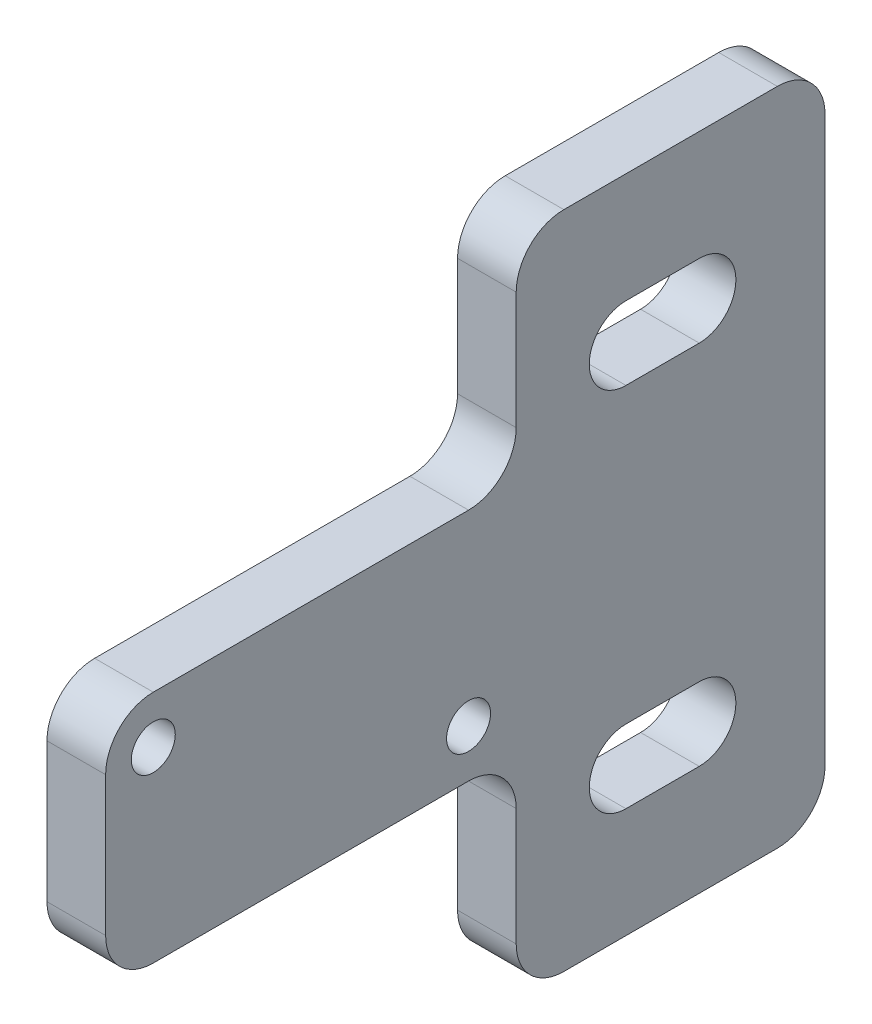
from build123d import *

# Parameters (mm, degrees)
SKETCH1_R           = 1.5
BOSS_EXTRUDE1_DEPTH = 4
FILLET1_R           = 3.25


with BuildPart() as part:
    # Sketch1 → Boss-Extrude1 (new body)
    with BuildSketch(Plane.YZ):
        Polygon((0, 28), (0, 0), (-14.5, 0), (-14.5, -21.061852547), (30.5, -21.061852547), (30.5, 0), (16, 0), (16, 28), align=None)
        with Locations((3.25, 3.25)):
            Circle(SKETCH1_R, mode=Mode.SUBTRACT)
        with Locations((12.75, 24.75)):
            Circle(SKETCH1_R, mode=Mode.SUBTRACT)
        with BuildLine():
            Line((23, -7.483396654), (23, -12.483396654))
            ThreePointArc((23, -12.483396654), (20.5, -14.983396654), (18, -12.483396654))
            Line((18, -12.483396654), (18, -7.483396654))
            ThreePointArc((18, -7.483396654), (20.5, -4.983396654), (23, -7.483396654))
        make_face(mode=Mode.SUBTRACT)
        with BuildLine():
            ThreePointArc((-7, -7.483396654), (-4.5, -4.983396654), (-2, -7.483396654))
            Line((-2, -7.483396654), (-2, -12.483396654))
            ThreePointArc((-2, -12.483396654), (-4.5, -14.983396654), (-7, -12.483396654))
            Line((-7, -12.483396654), (-7, -7.483396654))
        make_face(mode=Mode.SUBTRACT)
    extrude(amount=BOSS_EXTRUDE1_DEPTH)

    # Fillet1
    fillet1_edges = [part.edges().sort_by_distance(p)[0] for p in [
        (2, 0, 28),
        (2, 16, 0),
        (2, 30.5, 0),
        (2, 30.5, -21.061852547),
        (2, -14.5, -21.061852547),
        (2, -14.5, 0),
        (2, 0, 0),
        (2, 16, 28),
    ]]
    fillet(fillet1_edges, radius=FILLET1_R)


solid = part.part
